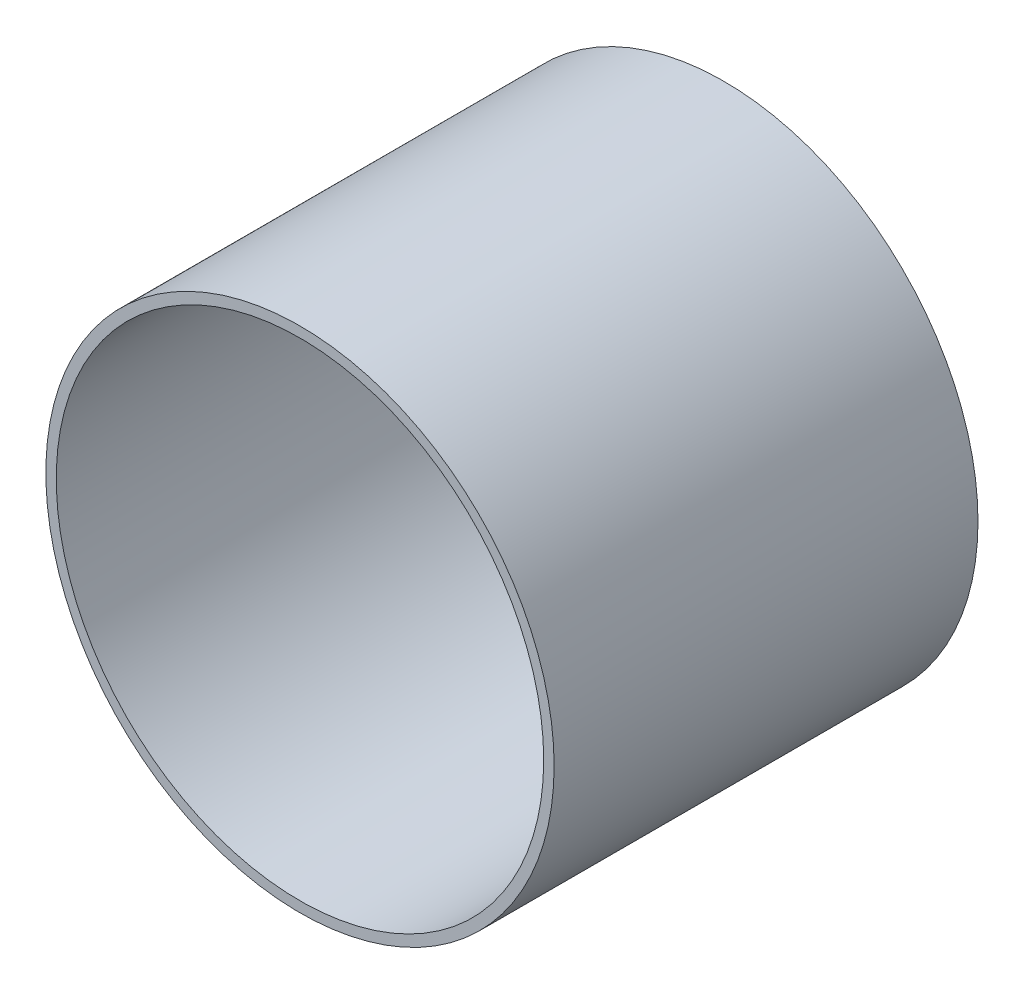
from build123d import *

# Parameters (mm, degrees)
SKETCH1_R           = 38.0746
SKETCH1_R_2         = 36.5125
BOSS_EXTRUDE1_DEPTH = 31.75


with BuildPart() as part:
    # Sketch1 → Boss-Extrude1 (new, symmetric)
    with BuildSketch(Plane.XY):
        Circle(SKETCH1_R)
        Circle(SKETCH1_R_2, mode=Mode.SUBTRACT)
    extrude(amount=BOSS_EXTRUDE1_DEPTH, both=True)


solid = part.part
